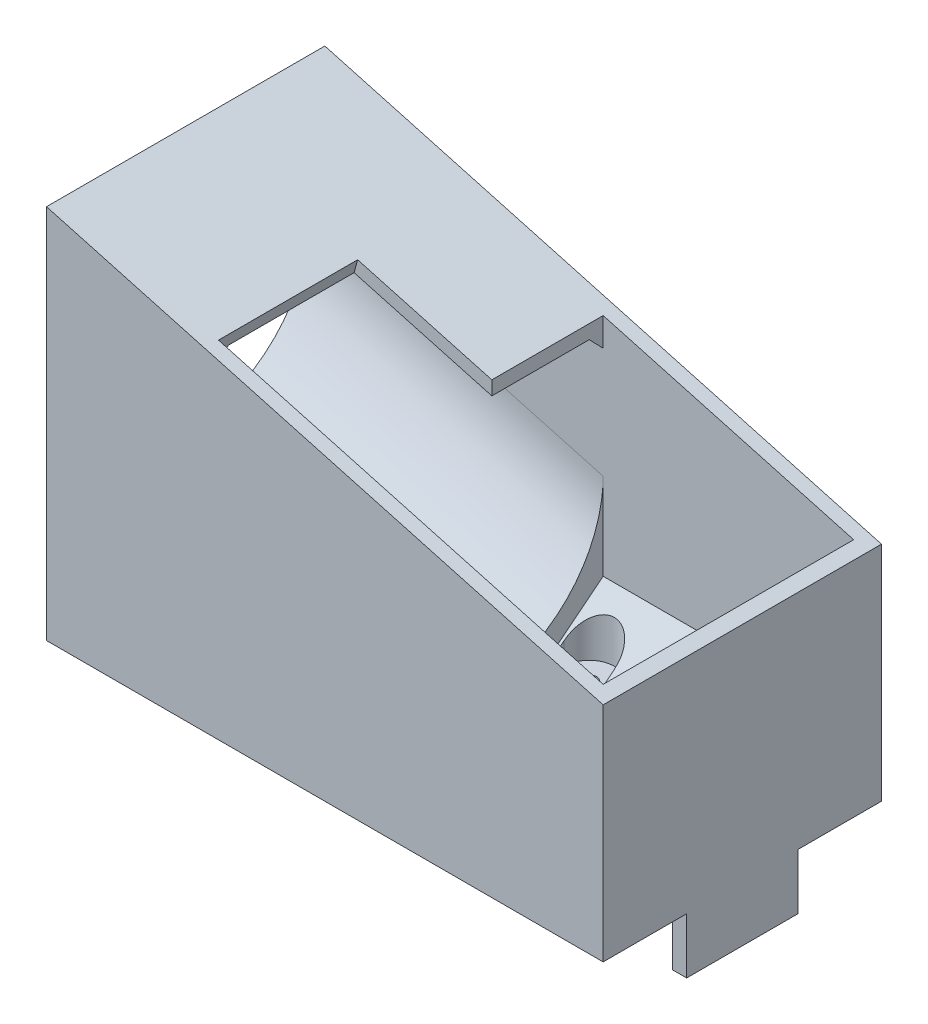
from build123d import *

# Parameters (mm, degrees)
EXTRUDE_1_DEPTH     = 100
SKETCH_2_W          = 90
SKETCH_2_H          = 40
CUT_EXTRUDE_1_DEPTH = 226
SKETCH_3_R          = 45
CUT_EXTRUDE_2_DEPTH = 20
SKETCH_6_W          = 100
SKETCH_6_H          = 100
CUT_EXTRUDE_3_DEPTH = 20
SKETCH_7_W          = 90
SKETCH_7_H          = 90
CUT_EXTRUDE_4_DEPTH = 193.093727175
SKETCH_8_R          = 2.6
CUT_EXTRUDE_5_DEPTH = 20
SKETCH_9_W          = 90
SKETCH_9_H          = 45
CHAMFER_1_SIZE      = 5
EXTRUDE_2_DEPTH     = 100
CUT_EXTRUDE_6_DEPTH = 130
SKETCH_13_W         = 111.657655416
SKETCH_13_H         = 22.995642515
CUT_EXTRUDE_7_DEPTH = 100
SKETCH_14_W         = 41.791274361
SKETCH_14_H         = 23.623821543
SKETCH_14_W_2       = 41.641022445
SKETCH_14_H_2       = 23.129786526
CUT_EXTRUDE_8_DEPTH = 100


with BuildPart() as part:
    # 草图1 → 凸台-拉伸1 (new body)
    with BuildSketch(Plane.XY):
        Polygon((-100, 0), (0, 0), (0, -20), (100, -20), (100, 100), (-100, 155), align=None)
    extrude(amount=EXTRUDE_1_DEPTH)

    # 草图2 → 切除-拉伸1 (cut, through all)
    with BuildSketch(Plane.XZ.offset(20)):
        with Locations((50, 50)):
            Rectangle(SKETCH_2_W, SKETCH_2_H)
    extrude(amount=-CUT_EXTRUDE_1_DEPTH, mode=Mode.SUBTRACT)

    # 切除-扫描1: sweep along a path in 草图4
    with BuildLine(Plane(origin=(0, 0, 0), x_dir=(-1, 0, 0), z_dir=(0, 0, -1))) as sweep_1_path:
        Line((100, 105), (-59.680389036, 61.087893015))
    # 草图3 → 切除-扫描1 (sweep, cut)
    with BuildSketch(Plane.ZY.offset(100)):
        with Locations((50, 105)):
            Circle(SKETCH_3_R)
    sweep(path=sweep_1_path.line, mode=Mode.SUBTRACT)

    # 草图5 → 切除-拉伸2 (cut)
    with BuildSketch(Plane(origin=(32.597327135, 118.535735038, 0), x_dir=(0.9642053928037904, -0.2651564830210423, 0), z_dir=(0.2651564830210423, 0.9642053928037904, 0))):
        Polygon((-28.621834457, -45), (-5.920504449, -45), (-5.920504449, -70), (-5.920504449, -95), (-78.621834457, -95), (-78.621834457, -45), align=None)
    extrude(amount=-CUT_EXTRUDE_2_DEPTH, mode=Mode.SUBTRACT)

    # 草图6 → 切除-拉伸3 (cut)
    with BuildSketch(Plane.XZ.offset(20)):
        with Locations((50, 50)):
            Rectangle(SKETCH_6_W, SKETCH_6_H)
    extrude(amount=-CUT_EXTRUDE_3_DEPTH, mode=Mode.SUBTRACT)

    # 草图7 → 切除-拉伸4 (cut, through all)
    with BuildSketch(Plane(origin=(0, 25, 0), x_dir=(1, 0, 0), z_dir=(0, 1, 0))):
        with Locations((50, -50)):
            Rectangle(SKETCH_7_W, SKETCH_7_H)
    extrude(amount=CUT_EXTRUDE_4_DEPTH, mode=Mode.SUBTRACT)

    # 草图8 → 切除-拉伸5 (cut)
    with BuildSketch(Plane(origin=(0, 25, 0), x_dir=(1, 0, 0), z_dir=(0, 1, 0))):
        with Locations((15, -80)):
            Circle(SKETCH_8_R)
        with Locations((85, -80)):
            Circle(SKETCH_8_R)
        with Locations((15, -20)):
            Circle(SKETCH_8_R)
        with Locations((85, -20)):
            Circle(SKETCH_8_R)
    extrude(amount=-CUT_EXTRUDE_5_DEPTH, mode=Mode.SUBTRACT)

    # 切除-扫描2: sweep along a path in 草图10
    with BuildLine(Plane(origin=(0, 0, 0), x_dir=(-1, 0, 0), z_dir=(0, 0, -1))) as sweep_2_path:
        Line((100, 105), (-53.327160523, 62.835030856))
    # 草图9 → 切除-扫描2 (sweep, cut)
    with BuildSketch(Plane.ZY.offset(100)):
        with Locations((50, 127.5)):
            Rectangle(SKETCH_9_W, SKETCH_9_H)
    sweep(path=sweep_2_path.line, mode=Mode.SUBTRACT)

    # 倒角1
    chamfer_1_edges = [part.edges().sort_by_distance(p)[0] for p in [
        (-72.244298097, 142.367181977, 95),
        (-47.5, 135.5625, 5),
    ]]
    chamfer(chamfer_1_edges, length=CHAMFER_1_SIZE)

    # 草图11 → 凸台-拉伸2 (add)
    with BuildSketch(Plane(origin=(100, 0, 0), x_dir=(0, 0, -1), z_dir=(1, 0, 0))):
        Polygon((-5, 25), (-5, 45), (-30, 25), align=None)
        Polygon((-70, 25), (-95, 45), (-95, 25), align=None)
    extrude(amount=-EXTRUDE_2_DEPTH)

    # 草图12 → 切除-拉伸6 (cut)
    with BuildSketch(Plane(origin=(0, 25, 0), x_dir=(1, 0, 0), z_dir=(0, 1, 0))):
        with BuildLine():
            ThreePointArc((24, -20), (15, -11), (6, -20))
            Line((6, -20), (6, -33.997897214))
            Line((6, -33.997897214), (24, -33.997897214))
            Line((24, -33.997897214), (24, -20))
        make_face()
        with BuildLine():
            ThreePointArc((94, -20), (85, -11), (76, -20))
            Line((76, -20), (76, -33.997897214))
            Line((76, -33.997897214), (94.684858204, -33.997897214))
            Line((94.684858204, -33.997897214), (94.684858204, -20))
            Line((94.684858204, -20), (94, -20))
        make_face()
        with BuildLine():
            ThreePointArc((6, -80), (15, -89), (24, -80))
            Line((24, -80), (24, -64.465838136))
            Line((24, -64.465838136), (6, -64.465838136))
            Line((6, -64.465838136), (6, -80))
        make_face()
        with BuildLine():
            Line((76, -65.718662232), (76, -80))
            ThreePointArc((76, -80), (85, -89), (94, -80))
            Line((94, -80), (94, -65.718662232))
            Line((94, -65.718662232), (76, -65.718662232))
        make_face()
    extrude(amount=CUT_EXTRUDE_6_DEPTH, mode=Mode.SUBTRACT)

    # 草图13 → 切除-拉伸7 (cut)
    with BuildSketch(Plane.ZY.offset(100)):
        with Locations((50.852348515, 8.502178742)):
            Rectangle(SKETCH_13_W, SKETCH_13_H)
    extrude(amount=-CUT_EXTRUDE_7_DEPTH, mode=Mode.SUBTRACT)

    # 草图14 → 切除-拉伸8 (cut)
    with BuildSketch(Plane(origin=(100, 0, 0), x_dir=(0, 0, -1), z_dir=(1, 0, 0))):
        with Locations((-9.10436282, 8.188089229)):
            Rectangle(SKETCH_14_W, SKETCH_14_H)
        with Locations((-90.820511223, 8.435106737)):
            Rectangle(SKETCH_14_W_2, SKETCH_14_H_2)
    extrude(amount=-CUT_EXTRUDE_8_DEPTH, mode=Mode.SUBTRACT)


solid = part.part
